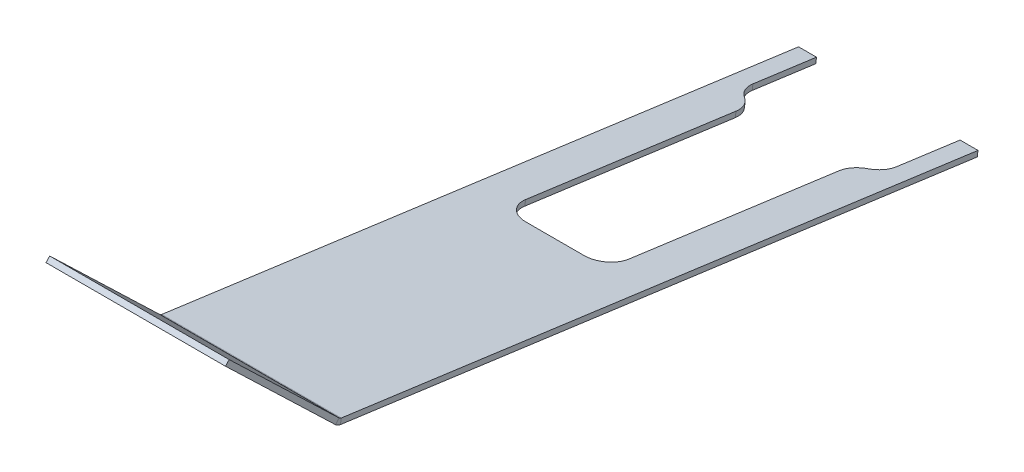
from build123d import *

# Parameters (mm, degrees)
SM_BASE_FLANGE_1_DEPTH = 100
CUT_EXTRUDE_1_DEPTH    = 867.216543549
FILLET_1_R             = 25


# Sheet-metal steps are written as plain solids
with BuildPart() as part:
    # Sketch 1 → 基体-法兰1 (new, symmetric)
    with BuildSketch(Plane(origin=(0, 0, 0), x_dir=(0, 0, -1), z_dir=(1, 0, 0))):
        with BuildLine():
            Line((0, 0), (122.650248882, -117.744238927))
            ThreePointArc((122.650248882, -117.744238927), (125.224977196, -119.534385204), (128.227535984, -120.439089748))
            Line((128.227535984, -120.439089748), (838, -217))
            Line((838, -217), (838.808818708, -211.054765581))
            Line((838.808818708, -211.054765581), (129.036354692, -114.493855329))
            ThreePointArc((129.036354692, -114.493855329), (127.835331177, -114.131973511), (126.805439851, -113.415915001))
            Line((126.805439851, -113.415915001), (4.155190969, 4.328323926))
            Line((4.155190969, 4.328323926), (0, 0))
        make_face()
    extrude(amount=SM_BASE_FLANGE_1_DEPTH, both=True)

    # 草图4 → 切除-拉伸1 (cut, through all)
    with BuildSketch(Plane(origin=(0, -95.177553726, 12.94841895), x_dir=(1, 0, 0), z_dir=(0, 0.9908724031816991, -0.13480311796440184))):
        with BuildLine():
            Line((-80, 859.603350465), (-80, 788.103350465))
            ThreePointArc((-80, 788.103350465), (-77.008521077, 776.244809239), (-68.75, 767.224234104))
            ThreePointArc((-68.75, 767.224234104), (-60.491478923, 758.203658969), (-57.5, 746.345117743))
            Line((-57.5, 746.345117743), (-57.5, 484.603350465))
            Line((-57.5, 484.603350465), (57.5, 484.603350465))
            Line((57.5, 484.603350465), (57.5, 746.345117743))
            ThreePointArc((57.5, 746.345117743), (60.491478923, 758.203658969), (68.75, 767.224234104))
            ThreePointArc((68.75, 767.224234104), (77.008521077, 776.244809239), (80, 788.103350465))
            Line((80, 788.103350465), (80, 859.603350465))
            Line((80, 859.603350465), (-80, 859.603350465))
        make_face()
    extrude(amount=-CUT_EXTRUDE_1_DEPTH, mode=Mode.SUBTRACT)

    # 圆角1
    fillet_1_edges = [part.edges().sort_by_distance(p)[0] for p in [
        (57.5, -163.476213554, -466.827258161),
        (-57.5, -163.476213554, -466.827258161),
    ]]
    fillet(fillet_1_edges, radius=FILLET_1_R)


solid = part.part
